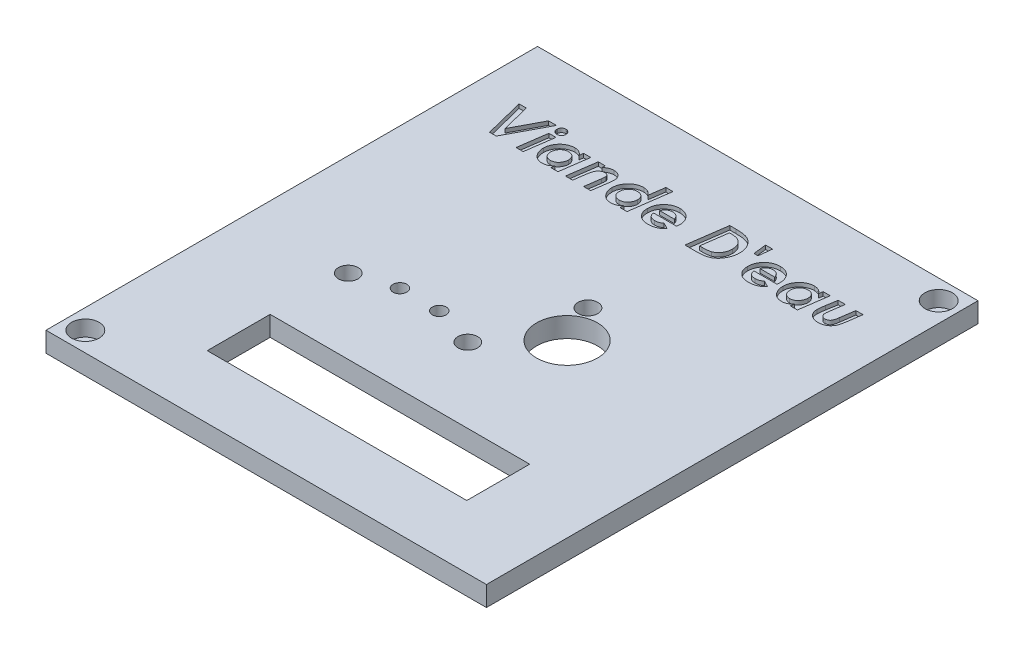
from build123d import *

# Parameters (mm, degrees)
SKETCH1_W           = 112
SKETCH1_H           = 125
BOSS_EXTRUDE1_DEPTH = 5.08
CUT_EXTRUDE1_REACH  = 86.072
SKETCH5_W           = 66
SKETCH5_H           = 16
SKETCH5_R           = 7.75
SKETCH5_R_2         = 2.5
SKETCH5_R_3         = 1.75
SKETCH7_R           = 3.5
CUT_EXTRUDE3_DEPTH  = 4
CUT_EXTRUDE4_DEPTH  = 1


with BuildPart() as part:
    # Sketch1 → Boss-Extrude1 (new body)
    with BuildSketch(Plane(origin=(0, 0, 0), x_dir=(1, 0, 0), z_dir=(0, 1, 0))):
        Rectangle(SKETCH1_W, SKETCH1_H)
    extrude(amount=BOSS_EXTRUDE1_DEPTH)

    # Sketch5 → Cut-Extrude1 (cut, up to next)
    with BuildSketch(Plane(origin=(0, 5.08, 0), x_dir=(1, 0, 0), z_dir=(0, 1, 0)), mode=Mode.PRIVATE) as cut_extrude1_sk1:
        with Locations((2, -38.5)):
            Rectangle(SKETCH5_W, SKETCH5_H)
    cut_extrude1_tool1 = extrude(cut_extrude1_sk1.sketch, amount=-CUT_EXTRUDE1_REACH, mode=Mode.PRIVATE) & part.part
    # Sketch5 → Cut-Extrude1 (cut, up to next)
    with BuildSketch(Plane(origin=(0, 5.08, 0), x_dir=(1, 0, 0), z_dir=(0, 1, 0)), mode=Mode.PRIVATE) as cut_extrude1_sk2:
        with Locations((12.5, 1.5)):
            Circle(SKETCH5_R)
    cut_extrude1_tool2 = extrude(cut_extrude1_sk2.sketch, amount=-CUT_EXTRUDE1_REACH, mode=Mode.PRIVATE) & part.part
    # Sketch5 → Cut-Extrude1 (cut, up to next)
    with BuildSketch(Plane(origin=(0, 5.08, 0), x_dir=(1, 0, 0), z_dir=(0, 1, 0)), mode=Mode.PRIVATE) as cut_extrude1_sk3:
        with Locations((-30.13, -11.51)):
            Circle(SKETCH5_R_2)
    cut_extrude1_tool3 = extrude(cut_extrude1_sk3.sketch, amount=-CUT_EXTRUDE1_REACH, mode=Mode.PRIVATE) & part.part
    # Sketch5 → Cut-Extrude1 (cut, up to next)
    with BuildSketch(Plane(origin=(0, 5.08, 0), x_dir=(1, 0, 0), z_dir=(0, 1, 0)), mode=Mode.PRIVATE) as cut_extrude1_sk4:
        with Locations((-20.25, -8.2495)):
            Circle(SKETCH5_R_3)
    cut_extrude1_tool4 = extrude(cut_extrude1_sk4.sketch, amount=-CUT_EXTRUDE1_REACH, mode=Mode.PRIVATE) & part.part
    # Sketch5 → Cut-Extrude1 (cut, up to next)
    with BuildSketch(Plane(origin=(0, 5.08, 0), x_dir=(1, 0, 0), z_dir=(0, 1, 0)), mode=Mode.PRIVATE) as cut_extrude1_sk5:
        with Locations((-10.25, -8.2495)):
            Circle(SKETCH5_R_3)
    cut_extrude1_tool5 = extrude(cut_extrude1_sk5.sketch, amount=-CUT_EXTRUDE1_REACH, mode=Mode.PRIVATE) & part.part
    # Sketch5 → Cut-Extrude1 (cut, up to next)
    with BuildSketch(Plane(origin=(0, 5.08, 0), x_dir=(1, 0, 0), z_dir=(0, 1, 0)), mode=Mode.PRIVATE) as cut_extrude1_sk6:
        with Locations((0.2695, -11.51)):
            Circle(SKETCH5_R_2)
    cut_extrude1_tool6 = extrude(cut_extrude1_sk6.sketch, amount=-CUT_EXTRUDE1_REACH, mode=Mode.PRIVATE) & part.part
    # Sketch5 → Cut-Extrude1 (cut, up to next)
    with BuildSketch(Plane(origin=(0, 5.08, 0), x_dir=(1, 0, 0), z_dir=(0, 1, 0)), mode=Mode.PRIVATE) as cut_extrude1_sk7:
        with Locations((8.001, 11.311)):
            Circle(SKETCH5_R_2)
    cut_extrude1_tool7 = extrude(cut_extrude1_sk7.sketch, amount=-CUT_EXTRUDE1_REACH, mode=Mode.PRIVATE) & part.part
    add(cut_extrude1_tool1.solids().sort_by_distance((2, 5.08, 38.5))[0], mode=Mode.SUBTRACT)
    add(cut_extrude1_tool2.solids().sort_by_distance((12.5, 5.08, -1.5))[0], mode=Mode.SUBTRACT)
    add(cut_extrude1_tool3.solids().sort_by_distance((-30.13, 5.08, 11.51))[0], mode=Mode.SUBTRACT)
    add(cut_extrude1_tool4.solids().sort_by_distance((-20.25, 5.08, 8.2495))[0], mode=Mode.SUBTRACT)
    add(cut_extrude1_tool5.solids().sort_by_distance((-10.25, 5.08, 8.2495))[0], mode=Mode.SUBTRACT)
    add(cut_extrude1_tool6.solids().sort_by_distance((0.2695, 5.08, 11.51))[0], mode=Mode.SUBTRACT)
    add(cut_extrude1_tool7.solids().sort_by_distance((8.001, 5.08, -11.311))[0], mode=Mode.SUBTRACT)

    # Sketch7 → Cut-Extrude3 (cut)
    with BuildSketch(Plane(origin=(0, 5.08, 0), x_dir=(1, 0, 0), z_dir=(0, 1, 0))):
        with Locations((-51, -57.5)):
            Circle(SKETCH7_R)
        with Locations((51, 57.5)):
            Circle(SKETCH7_R)
    extrude(amount=-CUT_EXTRUDE3_DEPTH, mode=Mode.SUBTRACT)

    # Sketch8 → Cut-Extrude4 (cut)
    # profile 1 of 12: a face of its own
    with BuildSketch(Plane(origin=(0, 5.08, 0), x_dir=(1, 0, 0), z_dir=(0, 1, 0))):
        Polygon((-45.701121795, 47.5), (-43.854166667, 47.5), (-42.051282051, 40.280448718), (-38.219150641, 47.5), (-36.203926282, 47.5), (-41.514423077, 37.5), (-43.203125, 37.5), align=None)
    # profile 2 of 12: a face of its own
    with BuildSketch(Plane(origin=(0, 5.08, 0), x_dir=(1, 0, 0), z_dir=(0, 1, 0))):
        with BuildLine():
            add(Edge.make_bspline(
                [(-34.166666667, 47.884615385), (-34.090168141, 47.880154588), (-33.939902581, 47.871392274), (-33.721996686, 47.808443635), (-33.525282026, 47.695851355), (-33.348226491, 47.549209407), (-33.201584542, 47.372153871), (-33.088992262, 47.175439211), (-33.026043624, 46.957533316), (-33.017281309, 46.807267757), (-33.012820513, 46.730769231)],
                knots=[0, 0, 0, 0, 1.014134371, 1.992057583, 2.975098753, 4, 5.024901247, 6.007942417, 6.985865629, 8, 8, 8, 8], degree=3))
            add(Edge.make_bspline(
                [(-33.012820513, 46.730769231), (-33.017250894, 46.65425342), (-33.025953463, 46.503953908), (-33.089503717, 46.285729419), (-33.200892841, 46.087630522), (-33.348398016, 45.910535017), (-33.524676948, 45.76327428), (-33.722610507, 45.653540087), (-33.939824205, 45.5900065), (-34.090141701, 45.58133675), (-34.166666667, 45.576923077)],
                knots=[0, 0, 0, 0, 1.013694729, 1.991193998, 2.981551723, 4.006008661, 5.030465598, 6.008806002, 6.986305271, 8, 8, 8, 8], degree=3))
            add(Edge.make_bspline(
                [(-34.166666667, 45.576923077), (-34.243208518, 45.581306562), (-34.39355918, 45.589917014), (-34.611099043, 45.654050805), (-34.810403902, 45.762583185), (-34.986731658, 45.910704239), (-35.134852712, 46.087031995), (-35.243385093, 46.286336855), (-35.307518884, 46.503876717), (-35.316129335, 46.65422738), (-35.320512821, 46.730769231)],
                knots=[0, 0, 0, 0, 1.01324697, 1.990314468, 2.975995575, 4, 5.024004425, 6.009685532, 6.98675303, 8, 8, 8, 8], degree=3))
            add(Edge.make_bspline(
                [(-35.320512821, 46.730769231), (-35.316099147, 46.807294197), (-35.307429397, 46.957611693), (-35.24389581, 47.174825391), (-35.134161618, 47.372758949), (-34.98690088, 47.549037882), (-34.809805376, 47.696543056), (-34.611706479, 47.80793218), (-34.39348199, 47.871482435), (-34.243182478, 47.880185004), (-34.166666667, 47.884615385)],
                knots=[0, 0, 0, 0, 1.013694729, 1.991193998, 2.969534402, 3.993991339, 5.018448277, 6.008806002, 6.986305271, 8, 8, 8, 8], degree=3))
        make_face()
    # profile 3 of 12: a face of its own
    with BuildSketch(Plane(origin=(0, 5.08, 0), x_dir=(1, 0, 0), z_dir=(0, 1, 0))):
        Polygon((-35.436698718, 44.807692308), (-33.625801282, 44.807692308), (-34.663461538, 37.5), (-36.474358974, 37.5), align=None)
    # profile 4 of 12: a face of its own
    with BuildSketch(Plane(origin=(0, 5.08, 0), x_dir=(1, 0, 0), z_dir=(0, 1, 0))):
        with BuildLine():
            Line((-26.590544872, 44.807692308), (-24.779647436, 44.807692308))
            Line((-24.779647436, 44.807692308), (-25.817307692, 37.5))
            Line((-25.817307692, 37.5), (-27.628205128, 37.5))
            Line((-27.628205128, 37.5), (-27.502003205, 38.393429487))
            add(Edge.make_bspline(
                [(-27.502003205, 38.393429487), (-27.596165009, 38.30380025), (-27.775714867, 38.132893192), (-28.0538057, 37.911169477), (-28.321500692, 37.730846121), (-28.585417776, 37.592540437), (-28.852806016, 37.49219743), (-29.130355838, 37.422696681), (-29.423710854, 37.379229714), (-29.624576983, 37.374314815), (-29.727564103, 37.371794872)],
                knots=[0, 0, 0, 0, 1.236324186, 2.357450916, 3.379388742, 4.30284698, 5.185433758, 6.089881904, 7.020653398, 8, 8, 8, 8], degree=3))
            add(Edge.make_bspline(
                [(-29.727564103, 37.371794872), (-29.845280738, 37.374537242), (-30.075822558, 37.37990803), (-30.41211944, 37.431881511), (-30.730039852, 37.513166924), (-31.029733509, 37.627863127), (-31.309581065, 37.777574259), (-31.572261767, 37.959060008), (-31.815400222, 38.174554488), (-32.035661884, 38.421207259), (-32.234304226, 38.68705184), (-32.407083008, 38.967971852), (-32.557110056, 39.257394635), (-32.673882925, 39.560607634), (-32.770277785, 39.871940162), (-32.834808102, 40.195544472), (-32.876434841, 40.529097145), (-32.881867435, 40.755081928), (-32.884615385, 40.869391026)],
                knots=[0, 0, 0, 0, 1.072254913, 2.099954687, 3.093402483, 4.05863531, 5.017013142, 5.979305845, 6.962352722, 7.970695896, 8.988290287, 9.983079422, 10.973839091, 11.95483031, 12.940586347, 13.940815436, 14.958409826, 16, 16, 16, 16], degree=3))
            add(Edge.make_bspline(
                [(-32.884615385, 40.869391026), (-32.883236568, 40.9575963), (-32.88049368, 41.133063612), (-32.853403031, 41.39479328), (-32.809262173, 41.652958862), (-32.748638316, 41.908417049), (-32.673071409, 42.161097798), (-32.578607589, 42.410092993), (-32.465295672, 42.654901272), (-32.337927797, 42.895815676), (-32.197340778, 43.129930558), (-32.039633622, 43.349667728), (-31.874083821, 43.559043029), (-31.69538113, 43.75395118), (-31.503975925, 43.933755895), (-31.303813837, 44.104126994), (-31.088449555, 44.256810443), (-30.865466716, 44.39978071), (-30.633570088, 44.524268592), (-30.399044252, 44.636138778), (-30.160077674, 44.727336176), (-29.919683931, 44.804535342), (-29.675767518, 44.862508288), (-29.42951941, 44.904179452), (-29.180650166, 44.931834347), (-29.013827951, 44.934541684), (-28.930288462, 44.935897436)],
                knots=[0, 0, 0, 0, 1.010861959, 2.01091412, 3.012605424, 4.011485121, 5.018863341, 6.033918867, 7.061452407, 8.109228878, 9.15680961, 10.18900835, 11.207521355, 12.215190347, 13.216881651, 14.216552911, 15.225616441, 16.240671966, 17.251099115, 18.240697123, 19.217272556, 20.180771028, 21.133199006, 22.08832996, 23.042693801, 24, 24, 24, 24], degree=3))
            add(Edge.make_bspline(
                [(-28.930288462, 44.935897436), (-28.819191581, 44.932732258), (-28.600203685, 44.926493238), (-28.279463882, 44.86800718), (-27.972201152, 44.775504956), (-27.679176072, 44.647228185), (-27.403989777, 44.4837752), (-27.154678182, 44.282434949), (-26.925608021, 44.051652657), (-26.800396424, 43.872881454), (-26.736778846, 43.782051282)],
                knots=[0, 0, 0, 0, 1.030509072, 2.031281277, 3.015697838, 4.003854478, 4.993584726, 5.977161716, 6.972235198, 8, 8, 8, 8], degree=3))
            Line((-26.736778846, 43.782051282), (-26.590544872, 44.807692308))
        make_face()
        with BuildLine():
            add(Edge.make_bspline(
                [(-29.324919872, 39.038461538), (-29.220494939, 39.041689162), (-29.016846835, 39.047983632), (-28.722629865, 39.103742438), (-28.448460591, 39.191548199), (-28.194753294, 39.317066724), (-27.960635481, 39.482149636), (-27.748124673, 39.68818553), (-27.556182532, 39.935002168), (-27.387852535, 40.215163443), (-27.247174137, 40.516474437), (-27.144101346, 40.827544421), (-27.078369053, 41.14240276), (-27.070989122, 41.354522178), (-27.067307692, 41.460336538)],
                knots=[0, 0, 0, 0, 1.017901168, 1.985097214, 2.910041334, 3.818973104, 4.735274743, 5.693545178, 6.695670165, 7.777101795, 8.875856117, 9.932619244, 10.968700869, 12, 12, 12, 12], degree=3))
            add(Edge.make_bspline(
                [(-27.067307692, 41.460336538), (-27.068991792, 41.526496479), (-27.072301419, 41.6565153), (-27.093935568, 41.846380913), (-27.131967002, 42.026240081), (-27.186535549, 42.19598169), (-27.256238672, 42.355788287), (-27.341592957, 42.506128365), (-27.44137962, 42.64594925), (-27.556076659, 42.775131514), (-27.684250922, 42.889581627), (-27.820151248, 42.994506579), (-27.970095537, 43.076898754), (-28.126815553, 43.148795928), (-28.294593943, 43.20182968), (-28.471147359, 43.243151159), (-28.658681953, 43.264153913), (-28.786683047, 43.267512596), (-28.852163462, 43.269230769)],
                knots=[0, 0, 0, 0, 1.109141645, 2.179707075, 3.198451464, 4.18615572, 5.163657463, 6.116161664, 7.079133258, 8.038519567, 9.005387219, 9.956904198, 10.909408399, 11.866440704, 12.843493655, 13.853714903, 14.902043453, 16, 16, 16, 16], degree=3))
            add(Edge.make_bspline(
                [(-28.852163462, 43.269230769), (-28.928415464, 43.267566333), (-29.078946805, 43.264280521), (-29.300150806, 43.230344404), (-29.513502676, 43.179673616), (-29.716936735, 43.103847069), (-29.912575584, 43.01038925), (-30.097377173, 42.892311546), (-30.274934462, 42.755491926), (-30.441477668, 42.598631444), (-30.593385826, 42.425069972), (-30.726337921, 42.237833532), (-30.839478702, 42.037989804), (-30.931669512, 41.825851283), (-31.001469235, 41.600508852), (-31.053989185, 41.364874349), (-31.084238345, 41.115904953), (-31.08787896, 40.946261872), (-31.08974359, 40.859375)],
                knots=[0, 0, 0, 0, 0.994897251, 1.964056203, 2.915642991, 3.853470011, 4.79324038, 5.741466074, 6.711095529, 7.716481674, 8.723680824, 9.71796663, 10.70964959, 11.717112863, 12.731868792, 13.785363818, 14.865719672, 16, 16, 16, 16], degree=3))
            add(Edge.make_bspline(
                [(-31.08974359, 40.859375), (-31.088029432, 40.792557497), (-31.084677254, 40.66189032), (-31.063597899, 40.470412262), (-31.022547959, 40.28973594), (-30.968644325, 40.118684656), (-30.90064345, 39.957093689), (-30.815946531, 39.805950891), (-30.715108919, 39.66497405), (-30.599582859, 39.535309025), (-30.470940934, 39.419876798), (-30.334614958, 39.316156782), (-30.187679412, 39.230280662), (-30.032139981, 39.159268084), (-29.867427054, 39.105306177), (-29.694124489, 39.068073327), (-29.512632706, 39.042607541), (-29.388445688, 39.039864629), (-29.324919872, 39.038461538)],
                knots=[0, 0, 0, 0, 1.124431694, 2.198919568, 3.234766021, 4.236791382, 5.213425507, 6.179206721, 7.145706547, 8.12447102, 9.094881178, 10.04988442, 11.001776355, 11.952075609, 12.922030374, 13.911569148, 14.931697721, 16, 16, 16, 16], degree=3))
        make_face(mode=Mode.SUBTRACT)
    # profile 5 of 12: a face of its own
    with BuildSketch(Plane(origin=(0, 5.08, 0), x_dir=(1, 0, 0), z_dir=(0, 1, 0))):
        with BuildLine():
            Line((-22.872596154, 44.807692308), (-21.061698718, 44.807692308))
            Line((-21.061698718, 44.807692308), (-21.17588141, 44.000400641))
            add(Edge.make_bspline(
                [(-21.17588141, 44.000400641), (-21.088807224, 44.074537439), (-20.918597248, 44.2194578), (-20.650791447, 44.409409918), (-20.382763712, 44.574477176), (-20.109020923, 44.703596167), (-19.834186255, 44.808230119), (-19.556322565, 44.881747101), (-19.275080076, 44.928365647), (-19.086717333, 44.933384208), (-18.992387821, 44.935897436)],
                knots=[0, 0, 0, 0, 1.129074261, 2.207080079, 3.239806547, 4.233987332, 5.191979582, 6.140686111, 7.068880775, 8, 8, 8, 8], degree=3))
            add(Edge.make_bspline(
                [(-18.992387821, 44.935897436), (-18.913539959, 44.933655668), (-18.758755356, 44.929254901), (-18.531843723, 44.904109201), (-18.316782141, 44.857417271), (-18.112219218, 44.79382962), (-17.920126055, 44.708116834), (-17.73590606, 44.60909327), (-17.565389279, 44.486875693), (-17.405660736, 44.350170529), (-17.262808211, 44.197957198), (-17.134731094, 44.037721439), (-17.02844261, 43.865715005), (-16.93934591, 43.684985249), (-16.871075476, 43.493375881), (-16.82328867, 43.292537314), (-16.794834635, 43.082411344), (-16.790878727, 42.939457897), (-16.788862179, 42.866586538)],
                knots=[0, 0, 0, 0, 1.118022855, 2.194767494, 3.230795032, 4.233728951, 5.225657328, 6.208555818, 7.193457995, 8.193528683, 9.184553253, 10.148487881, 11.096723343, 12.045053303, 13.000209424, 13.973718189, 14.967090947, 16, 16, 16, 16], degree=3))
            add(Edge.make_bspline(
                [(-16.788862179, 42.866586538), (-16.791023067, 42.787773613), (-16.795807547, 42.613271821), (-16.816132661, 42.32507586), (-16.856384753, 41.986184279), (-16.888092814, 41.742751195), (-16.905048077, 41.612580128)],
                knots=[0, 0, 0, 0, 0.750743129, 1.6622403, 2.749928862, 4, 4, 4, 4], degree=3))
            Line((-16.905048077, 41.612580128), (-17.483974359, 37.5))
            Line((-17.483974359, 37.5), (-19.294871795, 37.5))
            Line((-19.294871795, 37.5), (-18.727964744, 41.522435897))
            add(Edge.make_bspline(
                [(-18.727964744, 41.522435897), (-18.715599095, 41.613869479), (-18.692520649, 41.7845152), (-18.665498261, 42.022163247), (-18.651220057, 42.223393291), (-18.647505357, 42.345071267), (-18.645833333, 42.399839744)],
                knots=[0, 0, 0, 0, 1.255630561, 2.343427635, 3.254360171, 4, 4, 4, 4], degree=3))
            add(Edge.make_bspline(
                [(-18.645833333, 42.399839744), (-18.648682752, 42.465566045), (-18.654147544, 42.591619997), (-18.701905772, 42.769616513), (-18.786362845, 42.922484556), (-18.903101454, 43.048703807), (-19.049174122, 43.148277804), (-19.222557594, 43.220969183), (-19.424510843, 43.262228843), (-19.567780818, 43.266811211), (-19.643429487, 43.269230769)],
                knots=[0, 0, 0, 0, 1.048265012, 2.010427263, 2.912347805, 3.810226671, 4.72992967, 5.714049657, 6.792984344, 8, 8, 8, 8], degree=3))
            add(Edge.make_bspline(
                [(-19.643429487, 43.269230769), (-19.72116936, 43.264906136), (-19.878586244, 43.256149106), (-20.114749236, 43.198316662), (-20.347523926, 43.096783475), (-20.578182309, 42.964409875), (-20.796679458, 42.797457691), (-20.989260995, 42.594762458), (-21.15744301, 42.364437207), (-21.273846502, 42.145952565), (-21.354939254, 41.945786584), (-21.415068056, 41.763781865), (-21.471628933, 41.5513111), (-21.529925588, 41.309687721), (-21.585360257, 41.037538905), (-21.641325037, 40.736436802), (-21.695646915, 40.404525028), (-21.727928593, 40.173016903), (-21.744791667, 40.052083333)],
                knots=[0, 0, 0, 0, 0.882065441, 1.786110384, 2.740104157, 3.754965612, 4.797500545, 5.847687264, 6.91599857, 8.024311006, 8.646136181, 9.364850473, 10.197408591, 11.140054438, 12.184569392, 13.348033438, 14.614684545, 16, 16, 16, 16], degree=3))
            Line((-21.744791667, 40.052083333), (-22.099358974, 37.5))
            Line((-22.099358974, 37.5), (-23.91025641, 37.5))
            Line((-23.91025641, 37.5), (-22.872596154, 44.807692308))
        make_face()
    # profile 6 of 12: a face of its own
    with BuildSketch(Plane(origin=(0, 5.08, 0), x_dir=(1, 0, 0), z_dir=(0, 1, 0))):
        with BuildLine():
            Line((-8.625801282, 47.756410256), (-6.816907051, 47.756410256))
            Line((-6.816907051, 47.756410256), (-8.255208333, 37.5))
            Line((-8.255208333, 37.5), (-10.064102564, 37.5))
            Line((-10.064102564, 37.5), (-9.939903846, 38.377403846))
            add(Edge.make_bspline(
                [(-9.939903846, 38.377403846), (-10.037041394, 38.290089598), (-10.222695667, 38.123210119), (-10.50497816, 37.90236628), (-10.780098531, 37.726603976), (-11.049938862, 37.590837104), (-11.322513271, 37.489506877), (-11.607353203, 37.423181768), (-11.907018949, 37.379184032), (-12.112549946, 37.374293343), (-12.217548077, 37.371794872)],
                knots=[0, 0, 0, 0, 1.224191978, 2.339738612, 3.35557837, 4.279346016, 5.166550601, 6.074424882, 7.016295399, 8, 8, 8, 8], degree=3))
            add(Edge.make_bspline(
                [(-12.217548077, 37.371794872), (-12.337926604, 37.374558334), (-12.573766458, 37.379972376), (-12.917451609, 37.431598333), (-13.242495081, 37.513526622), (-13.549564589, 37.627800214), (-13.837009965, 37.777032118), (-14.106069791, 37.958276479), (-14.353226013, 38.175167353), (-14.579978549, 38.420233658), (-14.781655165, 38.687777871), (-14.96193294, 38.966604908), (-15.112361038, 39.257957418), (-15.234617037, 39.559998325), (-15.332032524, 39.871947805), (-15.399508122, 40.195282115), (-15.440378546, 40.529130036), (-15.445916636, 40.755092976), (-15.448717949, 40.869391026)],
                knots=[0, 0, 0, 0, 1.084756537, 2.125203127, 3.125436952, 4.102778343, 5.072150728, 6.038977154, 7.020481913, 8.030147435, 9.044022342, 10.037711967, 11.020545278, 11.995435886, 12.972332138, 13.96300789, 14.969635358, 16, 16, 16, 16], degree=3))
            add(Edge.make_bspline(
                [(-15.448717949, 40.869391026), (-15.447350493, 40.957598719), (-15.444630204, 41.133070845), (-15.417371358, 41.394764688), (-15.373842717, 41.653220059), (-15.310731295, 41.908507581), (-15.232610002, 42.160688995), (-15.139256257, 42.410642036), (-15.02299301, 42.654752896), (-14.894556953, 42.896626545), (-14.748691037, 43.128623473), (-14.592167426, 43.351039683), (-14.421930623, 43.559044207), (-14.239452488, 43.753358859), (-14.045943252, 43.934481187), (-13.841698359, 44.104072302), (-13.622483225, 44.2568845), (-13.39541477, 44.399738002), (-13.159168558, 44.52486899), (-12.919463385, 44.635669785), (-12.676104031, 44.727432252), (-12.431658051, 44.804532364), (-12.183757028, 44.862516159), (-11.93350818, 44.904181055), (-11.679975707, 44.931907311), (-11.509821436, 44.934562552), (-11.424278846, 44.935897436)],
                knots=[0, 0, 0, 0, 1.001967791, 1.993220895, 2.986098719, 3.977961405, 4.97869321, 5.984817669, 7.006498751, 8.048625242, 9.094941425, 10.118058263, 11.137144237, 12.14626801, 13.144667405, 14.147209555, 15.159750235, 16.178723228, 17.193620539, 18.195157345, 19.177309233, 20.146807454, 21.105618391, 22.067306845, 23.028366579, 24, 24, 24, 24], degree=3))
            add(Edge.make_bspline(
                [(-11.424278846, 44.935897436), (-11.311168059, 44.932044965), (-11.088100298, 44.92444744), (-10.761190764, 44.864178897), (-10.447679683, 44.768492535), (-10.150873625, 44.630829284), (-9.871150316, 44.458896128), (-9.615240864, 44.249336822), (-9.385690388, 44.002234352), (-9.257832654, 43.815211824), (-9.192708333, 43.719951923)],
                knots=[0, 0, 0, 0, 1.021752344, 2.015015653, 2.994318812, 3.977315891, 4.96380846, 5.954501398, 6.958125541, 8, 8, 8, 8], degree=3))
            Line((-9.192708333, 43.719951923), (-8.625801282, 47.756410256))
        make_face()
        with BuildLine():
            add(Edge.make_bspline(
                [(-11.834935897, 39.038461538), (-11.727846275, 39.041692581), (-11.518907673, 39.047996548), (-11.216759182, 39.103767765), (-10.934630911, 39.191476689), (-10.673054623, 39.316984869), (-10.430958636, 39.481240673), (-10.212286924, 39.68798175), (-10.014023669, 39.934587293), (-9.840180915, 40.215014305), (-9.692400078, 40.515430222), (-9.588443256, 40.827551692), (-9.519708216, 41.142153745), (-9.512705717, 41.354483346), (-9.509214744, 41.460336538)],
                knots=[0, 0, 0, 0, 1.029364739, 2.008355467, 2.944869541, 3.864220442, 4.788874237, 5.747766117, 6.747937481, 7.824404024, 8.916094465, 9.960164733, 10.983075963, 12, 12, 12, 12], degree=3))
            add(Edge.make_bspline(
                [(-9.509214744, 41.460336538), (-9.510732019, 41.526509124), (-9.513715639, 41.656633057), (-9.537745146, 41.846541308), (-9.578484548, 42.025914346), (-9.631884173, 42.196496723), (-9.704442823, 42.355757063), (-9.791354938, 42.506813392), (-9.89553013, 42.646009091), (-10.014098212, 42.775245054), (-10.146266677, 42.889663643), (-10.28621809, 42.994593339), (-10.440132016, 43.076888973), (-10.601386935, 43.149218754), (-10.774657657, 43.201769854), (-10.956532728, 43.242956441), (-11.149336001, 43.264258188), (-11.280671708, 43.267542938), (-11.348157051, 43.269230769)],
                knots=[0, 0, 0, 0, 1.092929283, 2.14917182, 3.155385987, 4.128652935, 5.096340581, 6.040415546, 7.002301806, 7.962478832, 8.931674171, 9.887023602, 10.844853392, 11.808066958, 12.802359889, 13.83011003, 14.885026967, 16, 16, 16, 16], degree=3))
            add(Edge.make_bspline(
                [(-11.348157051, 43.269230769), (-11.427078469, 43.267593637), (-11.582262591, 43.264374524), (-11.810113967, 43.230342353), (-12.029431944, 43.179688994), (-12.238863571, 43.103884119), (-12.440505263, 43.010502904), (-12.631229328, 42.892331861), (-12.814860199, 42.756345704), (-12.985334724, 42.597994313), (-13.143384246, 42.425841266), (-13.280393016, 42.238394754), (-13.395688474, 42.038103392), (-13.488988992, 41.825509296), (-13.5648781, 41.601316948), (-13.615079367, 41.364599561), (-13.649137462, 41.11610618), (-13.652251836, 40.946301733), (-13.653846154, 40.859375)],
                knots=[0, 0, 0, 0, 1.015017545, 1.99584108, 2.958882485, 3.907551637, 4.857154596, 5.813732046, 6.790026937, 7.79362874, 8.803576363, 9.793693459, 10.775457832, 11.771969563, 12.777519716, 13.815952619, 14.881936806, 16, 16, 16, 16], degree=3))
            add(Edge.make_bspline(
                [(-13.653846154, 40.859375), (-13.652385986, 40.792523704), (-13.649528753, 40.661710169), (-13.624870534, 40.470626313), (-13.585359893, 40.289324751), (-13.528395359, 40.118725257), (-13.459179712, 39.956347823), (-13.369526644, 39.806544323), (-13.267332764, 39.664186198), (-13.147416212, 39.535302307), (-13.014983369, 39.419744279), (-12.874535338, 39.316160869), (-12.723234158, 39.229681609), (-12.562562334, 39.159733342), (-12.393449505, 39.105239664), (-12.215480446, 39.067895923), (-12.028630803, 39.042643307), (-11.900460787, 39.039876186), (-11.834935897, 39.038461538)],
                knots=[0, 0, 0, 0, 1.107979885, 2.168077127, 3.188767881, 4.179540202, 5.146268969, 6.108932095, 7.067768028, 8.04709314, 9.01982551, 9.978661443, 10.935770145, 11.902498912, 12.87931775, 13.876010336, 14.914143953, 16, 16, 16, 16], degree=3))
        make_face(mode=Mode.SUBTRACT)
    # profile 7 of 12: a face of its own
    with BuildSketch(Plane(origin=(0, 5.08, 0), x_dir=(1, 0, 0), z_dir=(0, 1, 0))):
        with BuildLine():
            Line((-0.977564103, 39.661458333), (0.590945513, 38.856169872))
            add(Edge.make_bspline(
                [(0.590945513, 38.856169872), (0.498284259, 38.745303126), (0.312034678, 38.522460412), (-0.02278649, 38.233641197), (-0.397389088, 37.977623233), (-0.813082133, 37.76112666), (-1.262011527, 37.58576748), (-1.739029186, 37.463711892), (-2.238892319, 37.38371554), (-2.580478905, 37.375816755), (-2.754407051, 37.371794872)],
                knots=[0, 0, 0, 0, 0.914244933, 1.837636877, 2.790537697, 3.784087733, 4.800790172, 5.83726639, 6.89878507, 8, 8, 8, 8], degree=3))
            add(Edge.make_bspline(
                [(-2.754407051, 37.371794872), (-2.890098853, 37.374101173), (-3.154229053, 37.378590491), (-3.539281456, 37.424653598), (-3.903155905, 37.494791739), (-4.24400304, 37.597936229), (-4.564727145, 37.725698771), (-4.861371466, 37.886408014), (-5.135866565, 38.076823883), (-5.388237585, 38.291770269), (-5.61248958, 38.533519257), (-5.810205866, 38.793654748), (-5.975003605, 39.075489471), (-6.112509398, 39.374207028), (-6.215800107, 39.694021775), (-6.292674575, 40.030994305), (-6.336377289, 40.388148264), (-6.342843054, 40.632229725), (-6.346153846, 40.757211538)],
                knots=[0, 0, 0, 0, 1.167516698, 2.272623801, 3.333371772, 4.353538571, 5.333382306, 6.300396664, 7.250661637, 8.204535574, 9.148031545, 10.083792083, 11.011414416, 11.952824574, 12.908912643, 13.898953575, 14.92416002, 16, 16, 16, 16], degree=3))
            add(Edge.make_bspline(
                [(-6.346153846, 40.757211538), (-6.343191024, 40.900992049), (-6.33736392, 41.183771011), (-6.276473484, 41.598140728), (-6.18267746, 41.99610608), (-6.051212263, 42.377442243), (-5.877820356, 42.740444396), (-5.672237217, 43.089320878), (-5.423508761, 43.417817326), (-5.142429221, 43.726772767), (-4.835191472, 44.008224156), (-4.509426038, 44.256999616), (-4.166231431, 44.466730755), (-3.808143829, 44.639271351), (-3.433473582, 44.773270181), (-3.043083159, 44.865840688), (-2.637478087, 44.926992976), (-2.361336658, 44.932904856), (-2.221554487, 44.935897436)],
                knots=[0, 0, 0, 0, 1.05529311, 2.075487762, 3.068699193, 4.055083011, 5.031283693, 6.018666653, 7.023995929, 8.051577733, 9.082465902, 10.079966066, 11.057287041, 12.031169187, 12.994424047, 13.973330935, 14.974104677, 16, 16, 16, 16], degree=3))
            add(Edge.make_bspline(
                [(-2.221554487, 44.935897436), (-2.136725939, 44.934014712), (-1.969510387, 44.930303454), (-1.721738688, 44.911154527), (-1.481975735, 44.8737951), (-1.248511714, 44.827263925), (-1.023276864, 44.762153953), (-0.805037826, 44.683349772), (-0.591541994, 44.594637872), (-0.388074932, 44.486922354), (-0.190959945, 44.370466365), (-0.006541567, 44.23612726), (0.169910088, 44.093002696), (0.335317045, 43.936170907), (0.487137695, 43.764771273), (0.630478325, 43.581993196), (0.761935457, 43.385224477), (0.884160561, 43.178422296), (0.991156932, 42.961351747), (1.088501226, 42.741127244), (1.165571005, 42.513833281), (1.233549537, 42.28386781), (1.281454653, 42.046939481), (1.32189723, 41.80675865), (1.340305669, 41.561449835), (1.344195745, 41.396919989), (1.346153846, 41.314102564)],
                knots=[0, 0, 0, 0, 1.072343926, 2.113823519, 3.137889586, 4.13760148, 5.120645553, 6.097657508, 7.069516392, 8.039614793, 9.005002879, 9.960565349, 10.920144366, 11.87525951, 12.837543921, 13.811635494, 14.808779264, 15.826321551, 16.845367656, 17.865985152, 18.866871901, 19.876579391, 20.894541571, 21.919893521, 22.952961626, 24, 24, 24, 24], degree=3))
            add(Edge.make_bspline(
                [(1.346153846, 41.314102564), (1.345297618, 41.25933122), (1.343520653, 41.145661923), (1.331027644, 40.967815465), (1.308697902, 40.776801863), (1.288480818, 40.644972609), (1.278044872, 40.576923077)],
                knots=[0, 0, 0, 0, 0.886860648, 1.840539587, 2.885298471, 4, 4, 4, 4], degree=3))
            Line((1.278044872, 40.576923077), (-4.551282051, 40.576923077))
            add(Edge.make_bspline(
                [(-4.551282051, 40.576923077), (-4.547456948, 40.519423051), (-4.539995053, 40.407253761), (-4.514804022, 40.243794298), (-4.471968678, 40.090305405), (-4.415462085, 39.945743277), (-4.347265154, 39.808451029), (-4.265352668, 39.679051518), (-4.166188561, 39.561507159), (-4.055432211, 39.45214302), (-3.931977575, 39.354453445), (-3.796363821, 39.270424273), (-3.651001334, 39.196476624), (-3.492293079, 39.140152105), (-3.323813373, 39.093115305), (-3.143922918, 39.062181334), (-2.953231425, 39.041050786), (-2.821911004, 39.039340628), (-2.754407051, 39.038461538)],
                knots=[0, 0, 0, 0, 1.040300458, 2.029386266, 2.980027991, 3.911437883, 4.828060054, 5.744444316, 6.66911896, 7.598419554, 8.551199615, 9.504589747, 10.47513087, 11.489753162, 12.539789264, 13.630032591, 14.781741895, 16, 16, 16, 16], degree=3))
            add(Edge.make_bspline(
                [(-2.754407051, 39.038461538), (-2.672214327, 39.04059688), (-2.50935632, 39.044827881), (-2.268342375, 39.07218517), (-2.034912281, 39.123645166), (-1.808464696, 39.1916054), (-1.588123982, 39.277033367), (-1.37793505, 39.387456161), (-1.171682391, 39.512819577), (-1.042821351, 39.611490057), (-0.977564103, 39.661458333)],
                knots=[0, 0, 0, 0, 1.027214308, 2.035339218, 3.025519259, 4.010199041, 4.987959988, 5.973205312, 6.973599434, 8, 8, 8, 8], degree=3))
        make_face()
        with BuildLine():
            add(Edge.make_bspline(
                [(-0.576923077, 41.858974359), (-0.612543273, 41.969033397), (-0.681130527, 42.180953827), (-0.830742677, 42.468643499), (-1.013373561, 42.714450086), (-1.229247792, 42.916609361), (-1.474231891, 43.074050302), (-1.743657387, 43.187920517), (-2.037712197, 43.258064842), (-2.242524592, 43.265440952), (-2.34775641, 43.269230769)],
                knots=[0, 0, 0, 0, 1.131480038, 2.178682812, 3.159669316, 4.117470342, 5.058967564, 5.99670948, 6.970717055, 8, 8, 8, 8], degree=3))
            add(Edge.make_bspline(
                [(-2.34775641, 43.269230769), (-2.453032715, 43.265533614), (-2.660689391, 43.258241005), (-2.962392693, 43.183936757), (-3.249808151, 43.069481019), (-3.516719256, 42.905749129), (-3.763767521, 42.703850853), (-3.975813035, 42.457211647), (-4.16268784, 42.176543555), (-4.25395719, 41.966806343), (-4.30088141, 41.858974359)],
                knots=[0, 0, 0, 0, 0.983432494, 1.939812791, 2.890131691, 3.868528921, 4.858194814, 5.863362488, 6.901492691, 8, 8, 8, 8], degree=3))
            Line((-4.30088141, 41.858974359), (-0.576923077, 41.858974359))
        make_face(mode=Mode.SUBTRACT)
    # profile 8 of 12: a face of its own
    with BuildSketch(Plane(origin=(0, 5.08, 0), x_dir=(1, 0, 0), z_dir=(0, 1, 0))):
        with BuildLine():
            Line((7.876602564, 47.5), (9.455128205, 47.5))
            add(Edge.make_bspline(
                [(9.455128205, 47.5), (9.634106235, 47.498521799), (9.980214992, 47.495663244), (10.482133416, 47.472093743), (10.947957331, 47.430492785), (11.378539094, 47.372914164), (11.773913708, 47.299454078), (12.134232182, 47.210503172), (12.459853631, 47.105271386), (12.7516854, 46.978832546), (13.020393288, 46.836949968), (13.272209479, 46.675055098), (13.511471105, 46.495169833), (13.739791639, 46.29843238), (13.952542943, 46.080521319), (14.152718994, 45.843733544), (14.341086009, 45.58858236), (14.517008508, 45.317716603), (14.675252399, 45.031326785), (14.813490646, 44.731992587), (14.932176702, 44.422552807), (15.026050674, 44.10130879), (15.100260856, 43.770082033), (15.154207215, 43.427581317), (15.187137931, 43.074235924), (15.190570549, 42.835274193), (15.192307692, 42.714342949)],
                knots=[0, 0, 0, 0, 1.508928034, 2.917973822, 4.235011166, 5.450779055, 6.579221784, 7.623755204, 8.577985451, 9.460610614, 10.301756591, 11.137250569, 11.981705789, 12.823774396, 13.675702816, 14.546470419, 15.435981066, 16.347923198, 17.267651715, 18.192054867, 19.125737078, 20.059147693, 21.011116727, 21.985721956, 22.980635317, 24, 24, 24, 24], degree=3))
            add(Edge.make_bspline(
                [(15.192307692, 42.714342949), (15.189866894, 42.58940158), (15.185015467, 42.34106316), (15.150204371, 41.973056882), (15.093907845, 41.612503198), (15.016309022, 41.259527411), (14.914108756, 40.913988723), (14.786500597, 40.577707715), (14.641201239, 40.247320849), (14.470455719, 39.929622795), (14.286317394, 39.624583734), (14.086954549, 39.339360232), (13.877855628, 39.074260126), (13.653762838, 38.832920294), (13.418980684, 38.611901543), (13.173421984, 38.411208968), (12.91443769, 38.233626464), (12.642319118, 38.07599913), (12.349821524, 37.937825926), (12.032467086, 37.820773345), (11.689280472, 37.720169223), (11.318619071, 37.641630294), (10.922251063, 37.577514726), (10.499046078, 37.531592321), (10.049052283, 37.506452628), (9.740281313, 37.502192868), (9.581330128, 37.5)],
                knots=[0, 0, 0, 0, 1.035326767, 2.057856534, 3.060426681, 4.057975219, 5.050723532, 6.043595218, 7.036960241, 8.039530388, 9.030318104, 9.988216712, 10.921569661, 11.826132526, 12.714780289, 13.59198308, 14.451536877, 15.31430869, 16.195534129, 17.128821459, 18.114698389, 19.15667332, 20.266554844, 21.441073174, 22.682698532, 24, 24, 24, 24], degree=3))
            Line((9.581330128, 37.5), (6.474358974, 37.5))
            Line((6.474358974, 37.5), (7.876602564, 47.5))
        make_face()
        with BuildLine():
            Line((9.453125, 45.833333333), (8.51963141, 39.166666667))
            Line((8.51963141, 39.166666667), (9.166666667, 39.166666667))
            add(Edge.make_bspline(
                [(9.166666667, 39.166666667), (9.286875704, 39.167282348), (9.518009732, 39.16846616), (9.851890139, 39.181718913), (10.160103696, 39.197495911), (10.442490999, 39.226791747), (10.700083863, 39.259390071), (10.931132452, 39.301859828), (11.138294218, 39.347509074), (11.264332893, 39.390612051), (11.32411859, 39.411057692)],
                knots=[0, 0, 0, 0, 1.323091274, 2.54399687, 3.677836413, 4.719289959, 5.668358043, 6.534823038, 7.305002022, 8, 8, 8, 8], degree=3))
            add(Edge.make_bspline(
                [(11.32411859, 39.411057692), (11.400936335, 39.440914151), (11.553541864, 39.500226756), (11.768757796, 39.615601528), (11.977571477, 39.737885101), (12.170851925, 39.881719259), (12.355450447, 40.037854647), (12.523982198, 40.212962018), (12.684629045, 40.400600863), (12.831697403, 40.604385257), (12.966146615, 40.821046614), (13.080643071, 41.052279529), (13.179507951, 41.295011483), (13.258673515, 41.551248409), (13.321399223, 41.818967188), (13.36425235, 42.098962699), (13.39417064, 42.391178842), (13.396334481, 42.590732766), (13.397435897, 42.692307692)],
                knots=[0, 0, 0, 0, 0.952655881, 1.892538673, 2.821337892, 3.750040712, 4.676008024, 5.615700279, 6.558436491, 7.532008524, 8.520486916, 9.505184105, 10.513747313, 11.549809891, 12.604882282, 13.692134403, 14.825273528, 16, 16, 16, 16], degree=3))
            add(Edge.make_bspline(
                [(13.397435897, 42.692307692), (13.396284924, 42.775801395), (13.394035411, 42.938985159), (13.376359503, 43.178587198), (13.343597666, 43.407840624), (13.300718732, 43.626873578), (13.243729203, 43.835494713), (13.175819168, 44.033660422), (13.096705725, 44.222805527), (12.970090539, 44.456113581), (12.789610786, 44.728311281), (12.525967749, 45.016015665), (12.219592957, 45.26179193), (11.934020232, 45.433548645), (11.684798036, 45.551073483), (11.480119986, 45.626327246), (11.260675073, 45.690927045), (11.026083486, 45.741515418), (10.777727505, 45.784979323), (10.513909227, 45.811039448), (10.235329073, 45.830341973), (10.044108292, 45.832318405), (9.945913462, 45.833333333)],
                knots=[0, 0, 0, 0, 0.941373656, 1.839862062, 2.706559874, 3.551131217, 4.354742518, 5.142827075, 5.911946928, 6.663057697, 8.133107042, 9.582556681, 11.0440985, 12.547036792, 13.328439944, 14.147940985, 15.003216405, 15.905576335, 16.852443473, 17.844335315, 18.893032825, 20, 20, 20, 20], degree=3))
            Line((9.945913462, 45.833333333), (9.453125, 45.833333333))
        make_face(mode=Mode.SUBTRACT)
    # profile 9 of 12: a face of its own
    with BuildSketch(Plane(origin=(0, 5.08, 0), x_dir=(1, 0, 0), z_dir=(0, 1, 0))):
        Polygon((18.141025641, 44.423076923), (17.115384615, 44.423076923), (16.730769231, 47.756410256), (18.525641026, 47.756410256), align=None)
    # profile 10 of 12: a face of its own
    with BuildSketch(Plane(origin=(0, 5.08, 0), x_dir=(1, 0, 0), z_dir=(0, 1, 0))):
        with BuildLine():
            Line((24.53525641, 39.661458333), (26.103766026, 38.856169872))
            add(Edge.make_bspline(
                [(26.103766026, 38.856169872), (26.011104772, 38.745303126), (25.82485519, 38.522460412), (25.490034023, 38.233641197), (25.115431425, 37.977623233), (24.69973838, 37.76112666), (24.250808986, 37.58576748), (23.773791326, 37.463711892), (23.273928194, 37.38371554), (22.932341608, 37.375816755), (22.758413462, 37.371794872)],
                knots=[0, 0, 0, 0, 0.914244933, 1.837636877, 2.790537697, 3.784087733, 4.800790172, 5.83726639, 6.89878507, 8, 8, 8, 8], degree=3))
            add(Edge.make_bspline(
                [(22.758413462, 37.371794872), (22.62272166, 37.374101173), (22.35859146, 37.378590491), (21.973539056, 37.424653598), (21.609664607, 37.494791739), (21.268817473, 37.597936229), (20.948093368, 37.725698771), (20.651449047, 37.886408014), (20.376953948, 38.076823883), (20.124582928, 38.291770269), (19.900330933, 38.533519257), (19.702614647, 38.793654748), (19.537816908, 39.075489471), (19.400311114, 39.374207028), (19.297020406, 39.694021775), (19.220145937, 40.030994305), (19.176443224, 40.388148264), (19.169977459, 40.632229725), (19.166666667, 40.757211538)],
                knots=[0, 0, 0, 0, 1.167516698, 2.272623801, 3.333371772, 4.353538571, 5.333382306, 6.300396664, 7.250661637, 8.204535574, 9.148031545, 10.083792083, 11.011414416, 11.952824574, 12.908912643, 13.898953575, 14.92416002, 16, 16, 16, 16], degree=3))
            add(Edge.make_bspline(
                [(19.166666667, 40.757211538), (19.169629489, 40.900992049), (19.175456593, 41.183771011), (19.236347029, 41.598140728), (19.330143053, 41.99610608), (19.46160825, 42.377442243), (19.635000157, 42.740444396), (19.840583295, 43.089320878), (20.089311752, 43.417817326), (20.370391292, 43.726772767), (20.67762904, 44.008224156), (21.003394475, 44.256999616), (21.346589082, 44.466730755), (21.704676684, 44.639271351), (22.079346931, 44.773270181), (22.469737354, 44.865840688), (22.875342426, 44.926992976), (23.151483855, 44.932904856), (23.291266026, 44.935897436)],
                knots=[0, 0, 0, 0, 1.05529311, 2.075487762, 3.068699193, 4.055083011, 5.031283693, 6.018666653, 7.023995929, 8.051577733, 9.082465902, 10.079966066, 11.057287041, 12.031169187, 12.994424047, 13.973330935, 14.974104677, 16, 16, 16, 16], degree=3))
            add(Edge.make_bspline(
                [(23.291266026, 44.935897436), (23.376094574, 44.934014712), (23.543310126, 44.930303454), (23.791081825, 44.911154527), (24.030844778, 44.8737951), (24.264308799, 44.827263925), (24.489543649, 44.762153953), (24.707782687, 44.683349772), (24.921278519, 44.594637872), (25.124745581, 44.486922354), (25.321860568, 44.370466365), (25.506278946, 44.23612726), (25.682730601, 44.093002696), (25.848137558, 43.936170907), (25.999958208, 43.764771273), (26.143298837, 43.581993196), (26.27475597, 43.385224477), (26.396981074, 43.178422296), (26.503977445, 42.961351747), (26.601321738, 42.741127244), (26.678391518, 42.513833281), (26.74637005, 42.28386781), (26.794275165, 42.046939481), (26.834717742, 41.80675865), (26.853126181, 41.561449835), (26.857016258, 41.396919989), (26.858974359, 41.314102564)],
                knots=[0, 0, 0, 0, 1.072343926, 2.113823519, 3.137889586, 4.13760148, 5.120645553, 6.097657508, 7.069516392, 8.039614793, 9.005002879, 9.960565349, 10.920144366, 11.87525951, 12.837543921, 13.811635494, 14.808779264, 15.826321551, 16.845367656, 17.865985152, 18.866871901, 19.876579391, 20.894541571, 21.919893521, 22.952961626, 24, 24, 24, 24], degree=3))
            add(Edge.make_bspline(
                [(26.858974359, 41.314102564), (26.858118131, 41.25933122), (26.856341166, 41.145661923), (26.843848157, 40.967815465), (26.821518414, 40.776801863), (26.801301331, 40.644972609), (26.790865385, 40.576923077)],
                knots=[0, 0, 0, 0, 0.886860648, 1.840539587, 2.885298471, 4, 4, 4, 4], degree=3))
            Line((26.790865385, 40.576923077), (20.961538462, 40.576923077))
            add(Edge.make_bspline(
                [(20.961538462, 40.576923077), (20.965363565, 40.519423051), (20.97282546, 40.407253761), (20.99801649, 40.243794298), (21.040851835, 40.090305405), (21.097358428, 39.945743277), (21.165555359, 39.808451029), (21.247467845, 39.679051518), (21.346631952, 39.561507159), (21.457388302, 39.45214302), (21.580842938, 39.354453445), (21.716456692, 39.270424273), (21.861819179, 39.196476624), (22.020527434, 39.140152105), (22.18900714, 39.093115305), (22.368897594, 39.062181334), (22.559589088, 39.041050786), (22.690909509, 39.039340628), (22.758413462, 39.038461538)],
                knots=[0, 0, 0, 0, 1.040300458, 2.029386266, 2.980027991, 3.911437883, 4.828060054, 5.744444316, 6.66911896, 7.598419554, 8.551199615, 9.504589747, 10.47513087, 11.489753162, 12.539789264, 13.630032591, 14.781741895, 16, 16, 16, 16], degree=3))
            add(Edge.make_bspline(
                [(22.758413462, 39.038461538), (22.840606186, 39.04059688), (23.003464193, 39.044827881), (23.244478138, 39.07218517), (23.477908232, 39.123645166), (23.704355817, 39.1916054), (23.924696531, 39.277033367), (24.134885463, 39.387456161), (24.341138122, 39.512819577), (24.469999162, 39.611490057), (24.53525641, 39.661458333)],
                knots=[0, 0, 0, 0, 1.027214308, 2.035339218, 3.025519259, 4.010199041, 4.987959988, 5.973205312, 6.973599434, 8, 8, 8, 8], degree=3))
        make_face()
        with BuildLine():
            add(Edge.make_bspline(
                [(24.935897436, 41.858974359), (24.90027724, 41.969033397), (24.831689986, 42.180953827), (24.682077836, 42.468643499), (24.499446952, 42.714450086), (24.28357272, 42.916609361), (24.038588622, 43.074050302), (23.769163125, 43.187920517), (23.475108316, 43.258064842), (23.270295921, 43.265440952), (23.165064103, 43.269230769)],
                knots=[0, 0, 0, 0, 1.131480038, 2.178682812, 3.159669316, 4.117470342, 5.058967564, 5.99670948, 6.970717055, 8, 8, 8, 8], degree=3))
            add(Edge.make_bspline(
                [(23.165064103, 43.269230769), (23.059787798, 43.265533614), (22.852131122, 43.258241005), (22.55042782, 43.183936757), (22.263012361, 43.069481019), (21.996101257, 42.905749129), (21.749052992, 42.703850853), (21.537007478, 42.457211647), (21.350132673, 42.176543555), (21.258863323, 41.966806343), (21.211939103, 41.858974359)],
                knots=[0, 0, 0, 0, 0.983432494, 1.939812791, 2.890131691, 3.868528921, 4.858194814, 5.863362488, 6.901492691, 8, 8, 8, 8], degree=3))
            Line((21.211939103, 41.858974359), (24.935897436, 41.858974359))
        make_face(mode=Mode.SUBTRACT)
    # profile 11 of 12: a face of its own
    with BuildSketch(Plane(origin=(0, 5.08, 0), x_dir=(1, 0, 0), z_dir=(0, 1, 0))):
        with BuildLine():
            Line((34.306891026, 44.807692308), (36.117788462, 44.807692308))
            Line((36.117788462, 44.807692308), (35.080128205, 37.5))
            Line((35.080128205, 37.5), (33.269230769, 37.5))
            Line((33.269230769, 37.5), (33.395432692, 38.393429487))
            add(Edge.make_bspline(
                [(33.395432692, 38.393429487), (33.301270888, 38.30380025), (33.12172103, 38.132893192), (32.843630197, 37.911169477), (32.575935205, 37.730846121), (32.312018121, 37.592540437), (32.044629882, 37.49219743), (31.76708006, 37.422696681), (31.473725043, 37.379229714), (31.272858914, 37.374314815), (31.169871795, 37.371794872)],
                knots=[0, 0, 0, 0, 1.236324186, 2.357450916, 3.379388742, 4.30284698, 5.185433758, 6.089881904, 7.020653398, 8, 8, 8, 8], degree=3))
            add(Edge.make_bspline(
                [(31.169871795, 37.371794872), (31.05215516, 37.374537242), (30.821613339, 37.37990803), (30.485316458, 37.431881511), (30.167396045, 37.513166924), (29.867702388, 37.627863127), (29.587854833, 37.777574259), (29.32517413, 37.959060008), (29.082035675, 38.174554488), (28.861774014, 38.421207259), (28.663131672, 38.68705184), (28.49035289, 38.967971852), (28.340325842, 39.257394635), (28.223552972, 39.560607634), (28.127158112, 39.871940162), (28.062627796, 40.195544472), (28.021001056, 40.529097145), (28.015568463, 40.755081928), (28.012820513, 40.869391026)],
                knots=[0, 0, 0, 0, 1.072254913, 2.099954687, 3.093402483, 4.05863531, 5.017013142, 5.979305845, 6.962352722, 7.970695896, 8.988290287, 9.983079422, 10.973839091, 11.95483031, 12.940586347, 13.940815436, 14.958409826, 16, 16, 16, 16], degree=3))
            add(Edge.make_bspline(
                [(28.012820513, 40.869391026), (28.014199329, 40.9575963), (28.016942217, 41.133063612), (28.044032866, 41.39479328), (28.088173725, 41.652958862), (28.148797582, 41.908417049), (28.224364488, 42.161097798), (28.318828308, 42.410092993), (28.432140225, 42.654901272), (28.5595081, 42.895815676), (28.700095119, 43.129930558), (28.857802276, 43.349667728), (29.023352076, 43.559043029), (29.202054768, 43.75395118), (29.393459973, 43.933755895), (29.593622061, 44.104126994), (29.808986342, 44.256810443), (30.031969182, 44.39978071), (30.263865809, 44.524268592), (30.498391645, 44.636138778), (30.737358224, 44.727336176), (30.977751967, 44.804535342), (31.221668379, 44.862508288), (31.467916487, 44.904179452), (31.716785732, 44.931834347), (31.883607946, 44.934541684), (31.967147436, 44.935897436)],
                knots=[0, 0, 0, 0, 1.010861959, 2.01091412, 3.012605424, 4.011485121, 5.018863341, 6.033918867, 7.061452407, 8.109228878, 9.15680961, 10.18900835, 11.207521355, 12.215190347, 13.216881651, 14.216552911, 15.225616441, 16.240671966, 17.251099115, 18.240697123, 19.217272556, 20.180771028, 21.133199006, 22.08832996, 23.042693801, 24, 24, 24, 24], degree=3))
            add(Edge.make_bspline(
                [(31.967147436, 44.935897436), (32.078244317, 44.932732258), (32.297232213, 44.926493238), (32.617972016, 44.86800718), (32.925234745, 44.775504956), (33.218259825, 44.647228185), (33.493446121, 44.4837752), (33.742757716, 44.282434949), (33.971827876, 44.051652657), (34.097039473, 43.872881454), (34.160657051, 43.782051282)],
                knots=[0, 0, 0, 0, 1.030509072, 2.031281277, 3.015697838, 4.003854478, 4.993584726, 5.977161716, 6.972235198, 8, 8, 8, 8], degree=3))
            Line((34.160657051, 43.782051282), (34.306891026, 44.807692308))
        make_face()
        with BuildLine():
            add(Edge.make_bspline(
                [(31.572516026, 39.038461538), (31.676940958, 39.041689162), (31.880589062, 39.047983632), (32.174806032, 39.103742438), (32.448975306, 39.191548199), (32.702682604, 39.317066724), (32.936800416, 39.482149636), (33.149311224, 39.68818553), (33.341253366, 39.935002168), (33.509583362, 40.215163443), (33.65026176, 40.516474437), (33.753334552, 40.827544421), (33.819066845, 41.14240276), (33.826446776, 41.354522178), (33.830128205, 41.460336538)],
                knots=[0, 0, 0, 0, 1.017901168, 1.985097214, 2.910041334, 3.818973104, 4.735274743, 5.693545178, 6.695670165, 7.777101795, 8.875856117, 9.932619244, 10.968700869, 12, 12, 12, 12], degree=3))
            add(Edge.make_bspline(
                [(33.830128205, 41.460336538), (33.828444105, 41.526496479), (33.825134478, 41.6565153), (33.803500329, 41.846380913), (33.765468895, 42.026240081), (33.710900348, 42.19598169), (33.641197226, 42.355788287), (33.555842941, 42.506128365), (33.456056277, 42.64594925), (33.341359238, 42.775131514), (33.213184975, 42.889581627), (33.077284649, 42.994506579), (32.92734036, 43.076898754), (32.770620344, 43.148795928), (32.602841955, 43.20182968), (32.426288539, 43.243151159), (32.238753944, 43.264153913), (32.110752851, 43.267512596), (32.045272436, 43.269230769)],
                knots=[0, 0, 0, 0, 1.109141645, 2.179707075, 3.198451464, 4.18615572, 5.163657463, 6.116161664, 7.079133258, 8.038519567, 9.005387219, 9.956904198, 10.909408399, 11.866440704, 12.843493655, 13.853714903, 14.902043453, 16, 16, 16, 16], degree=3))
            add(Edge.make_bspline(
                [(32.045272436, 43.269230769), (31.969020434, 43.267566333), (31.818489092, 43.264280521), (31.597285092, 43.230344404), (31.383933221, 43.179673616), (31.180499162, 43.103847069), (30.984860314, 43.01038925), (30.800058725, 42.892311546), (30.622501436, 42.755491926), (30.455958229, 42.598631444), (30.304050071, 42.425069972), (30.171097976, 42.237833532), (30.057957195, 42.037989804), (29.965766385, 41.825851283), (29.895966662, 41.600508852), (29.843446712, 41.364874349), (29.813197553, 41.115904953), (29.809556938, 40.946261872), (29.807692308, 40.859375)],
                knots=[0, 0, 0, 0, 0.994897251, 1.964056203, 2.915642991, 3.853470011, 4.79324038, 5.741466074, 6.711095529, 7.716481674, 8.723680824, 9.71796663, 10.70964959, 11.717112863, 12.731868792, 13.785363818, 14.865719672, 16, 16, 16, 16], degree=3))
            add(Edge.make_bspline(
                [(29.807692308, 40.859375), (29.809406466, 40.792557497), (29.812758644, 40.66189032), (29.833837998, 40.470412262), (29.874887938, 40.28973594), (29.928791572, 40.118684656), (29.996792448, 39.957093689), (30.081489366, 39.805950891), (30.182326979, 39.66497405), (30.297853038, 39.535309025), (30.426494963, 39.419876798), (30.562820939, 39.316156782), (30.709756486, 39.230280662), (30.865295917, 39.159268084), (31.030008843, 39.105306177), (31.203311409, 39.068073327), (31.384803191, 39.042607541), (31.508990209, 39.039864629), (31.572516026, 39.038461538)],
                knots=[0, 0, 0, 0, 1.124431694, 2.198919568, 3.234766021, 4.236791382, 5.213425507, 6.179206721, 7.145706547, 8.12447102, 9.094881178, 10.04988442, 11.001776355, 11.952075609, 12.922030374, 13.911569148, 14.931697721, 16, 16, 16, 16], degree=3))
        make_face(mode=Mode.SUBTRACT)
    # profile 12 of 12: a face of its own
    with BuildSketch(Plane(origin=(0, 5.08, 0), x_dir=(1, 0, 0), z_dir=(0, 1, 0))):
        with BuildLine():
            Line((38.139022436, 44.807692308), (39.949919872, 44.807692308))
            Line((39.949919872, 44.807692308), (39.417067308, 41.09775641))
            add(Edge.make_bspline(
                [(39.417067308, 41.09775641), (39.404702235, 41.001646334), (39.381629035, 40.822305126), (39.354605899, 40.572635566), (39.34026755, 40.360735497), (39.33659744, 40.232385719), (39.334935897, 40.174278846)],
                knots=[0, 0, 0, 0, 1.253526504, 2.339077935, 3.248062684, 4, 4, 4, 4], degree=3))
            add(Edge.make_bspline(
                [(39.334935897, 40.174278846), (39.338160834, 40.09695883), (39.344479147, 39.945473034), (39.412699832, 39.730218794), (39.516059058, 39.531954125), (39.662650642, 39.359730123), (39.841310665, 39.215537022), (40.049989706, 39.112849729), (40.282643004, 39.048219529), (40.446272326, 39.041786602), (40.530849359, 39.038461538)],
                knots=[0, 0, 0, 0, 1.002835694, 1.964761131, 2.909147679, 3.895784594, 4.884866332, 5.875587295, 6.90192956, 8, 8, 8, 8], degree=3))
            add(Edge.make_bspline(
                [(40.530849359, 39.038461538), (40.586332213, 39.03940847), (40.694348035, 39.041251988), (40.851422516, 39.061527837), (40.998200315, 39.095725778), (41.135179806, 39.14178475), (41.262739912, 39.199773931), (41.379991046, 39.272384554), (41.486027733, 39.359447814), (41.586083845, 39.459515824), (41.674350939, 39.583526765), (41.758973632, 39.729794212), (41.833637768, 39.904821039), (41.906484732, 40.10490854), (41.968750973, 40.333822075), (42.026914228, 40.589097208), (42.078617436, 40.871203897), (42.106748693, 41.068933906), (42.121394231, 41.171875)],
                knots=[0, 0, 0, 0, 0.892108868, 1.736786517, 2.541881516, 3.312938247, 4.057891121, 4.791136306, 5.524224126, 6.261001152, 7.060198994, 7.964829526, 8.974738879, 10.116351085, 11.388184609, 12.787440625, 14.327495265, 16, 16, 16, 16], degree=3))
            Line((42.121394231, 41.171875), (42.640224359, 44.807692308))
            Line((42.640224359, 44.807692308), (44.453125, 44.807692308))
            Line((44.453125, 44.807692308), (43.894230769, 40.895432692))
            add(Edge.make_bspline(
                [(43.894230769, 40.895432692), (43.878296903, 40.789139045), (43.847238549, 40.581951045), (43.789191543, 40.281192376), (43.72242869, 39.998897275), (43.652482691, 39.73381474), (43.568650285, 39.489405287), (43.482217317, 39.261410276), (43.383119963, 39.053574923), (43.246770822, 38.801605572), (43.049802489, 38.51950298), (42.779151554, 38.218461086), (42.470970739, 37.960726989), (42.127339979, 37.747528658), (41.751486113, 37.576946639), (41.341995981, 37.458444508), (40.901450699, 37.384408284), (40.597261439, 37.376080771), (40.440705128, 37.371794872)],
                knots=[0, 0, 0, 0, 0.938282912, 1.828904783, 2.673080473, 3.47068305, 4.220973376, 4.927886656, 5.59807994, 6.229421123, 7.427669869, 8.591533972, 9.754419504, 10.92230609, 12.112044702, 13.346047806, 14.63409719, 16, 16, 16, 16], degree=3))
            add(Edge.make_bspline(
                [(40.440705128, 37.371794872), (40.329752678, 37.373958069), (40.113244777, 37.378179239), (39.797034249, 37.415308681), (39.498355132, 37.473934327), (39.217907123, 37.559517935), (38.953082667, 37.66483013), (38.707133339, 37.797515082), (38.477525945, 37.953136775), (38.268898976, 38.132889924), (38.080658803, 38.331153861), (37.915170869, 38.543926213), (37.775987404, 38.771680936), (37.66352659, 39.013955654), (37.575525381, 39.269156989), (37.510713969, 39.537935408), (37.472120872, 39.821252034), (37.468031413, 40.015237161), (37.465945513, 40.114182692)],
                knots=[0, 0, 0, 0, 1.168632583, 2.280420012, 3.349725486, 4.371307417, 5.365511249, 6.347568045, 7.309587773, 8.282530155, 9.242979364, 10.185822766, 11.117310968, 12.048958566, 12.994554036, 13.956959565, 14.957911239, 16, 16, 16, 16], degree=3))
            add(Edge.make_bspline(
                [(37.465945513, 40.114182692), (37.467101589, 40.178955552), (37.469485914, 40.31254506), (37.476735441, 40.519715991), (37.493751444, 40.740048458), (37.515915362, 40.974435818), (37.543114829, 41.222418156), (37.581084462, 41.483093479), (37.619297734, 41.757369257), (37.651695929, 41.943862282), (37.668269231, 42.039262821)],
                knots=[0, 0, 0, 0, 0.80233306, 1.654755999, 2.566827454, 3.538651181, 4.570611162, 5.655930814, 6.800891005, 8, 8, 8, 8], degree=3))
            Line((37.668269231, 42.039262821), (38.139022436, 44.807692308))
        make_face()
    extrude(amount=-CUT_EXTRUDE4_DEPTH, mode=Mode.SUBTRACT)


solid = part.part
